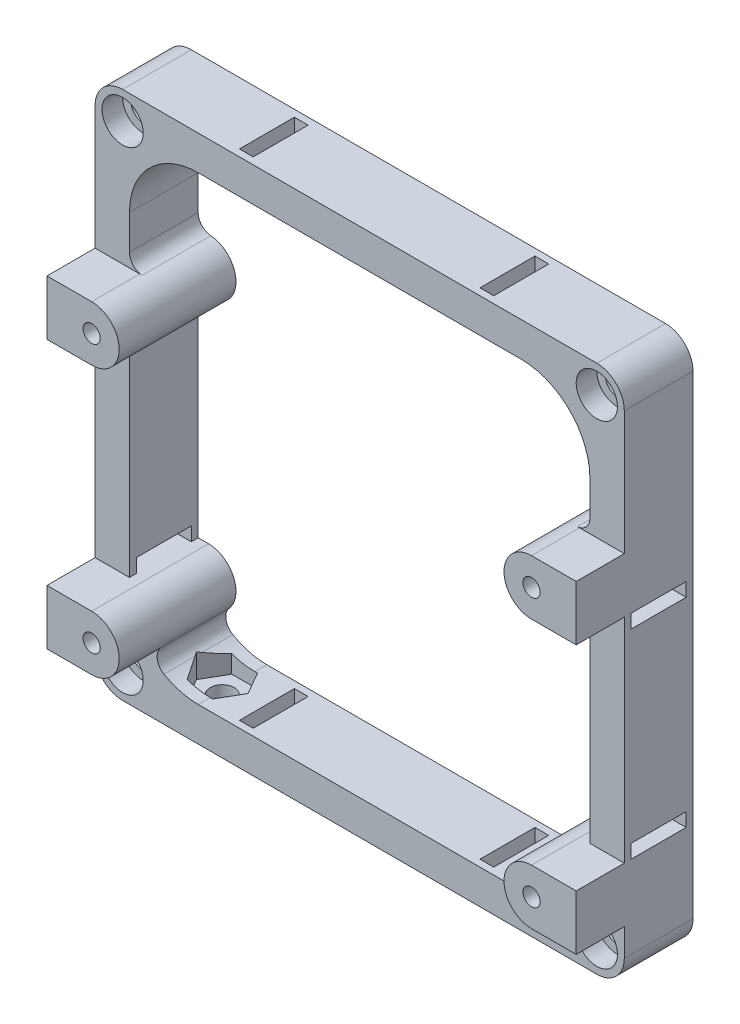
from build123d import *

# Parameters (mm, degrees)
SKETCH1_W               = 77
SKETCH1_H               = 77
SKETCH1_W_2             = 67
SKETCH1_H_2             = 67
EXTRUDE_THIN1_DEPTH     = 10
FILLET2_R               = 10
FILLET1_R               = 4
SKETCH2_R               = 1.7500000000000038
CUT_EXTRUDE1_DEPTH      = 56.35792626173781
SKETCH3_R               = 3.0000000000000018
CUT_EXTRUDE2_DEPTH      = 3
MIRROR2_COPY_1_SKETCH_R = 1.7500000000000038
MIRROR2_COPY_1_DEPTH    = 56.35792626173781
MIRROR2_COPY_2_SKETCH_R = 3.0000000000000018
MIRROR2_COPY_2_DEPTH    = 3
BOSS_EXTRUDE2_DEPTH     = 17
SKETCH5_R               = 1.2499999999999978
CUT_EXTRUDE3_DEPTH      = 8
LPATTERN1_COUNT         = 2
LPATTERN1_PITCH         = 39
MIRROR3_COPY_1_DEPTH    = 17
MIRROR3_COPY_2_SKETCH_R = 1.2499999999999978
MIRROR3_COPY_2_DEPTH    = 8
CUT_EXTRUDE6_REACH      = 89.751
SKETCH9_R               = 1.7500000000000002
CUT_EXTRUDE7_REACH      = 92.751
CUT_EXTRUDE7_START      = -3
CUT_EXTRUDE8_START      = 1
SKETCH11_W              = 4.999999999999986
SKETCH11_H              = 1.9999999999999991
CUT_EXTRUDE8_DEPTH      = 8
LPATTERN2_COUNT         = 2
LPATTERN2_PITCH         = 29
MIRROR5_START           = 1
MIRROR5_COPY_1_SKETCH_W = 4.999999999999986
MIRROR5_COPY_1_SKETCH_H = 1.9999999999999991
MIRROR5_COPY_1_DEPTH    = 8
CUT_EXTRUDE9_START      = 1
CUT_EXTRUDE9_DEPTH      = 8
FILLET3_R               = 2
FILLET4_R               = 2


with BuildPart() as part:
    # Sketch1 → Extrude-Thin1 (new body)
    with BuildSketch(Plane.XY):
        Rectangle(SKETCH1_W, SKETCH1_H)
        Rectangle(SKETCH1_W_2, SKETCH1_H_2, mode=Mode.SUBTRACT)
    extrude(amount=EXTRUDE_THIN1_DEPTH)

    # Fillet2
    fillet2_edges = [part.edges().sort_by_distance(p)[0] for p in [
        (33.49999999999999, -33.50000000000001, 5),
        (33.49999999999999, 33.49999999999999, 5),
        (-33.50000000000001, 33.49999999999999, 5),
        (-33.50000000000001, -33.50000000000001, 5),
    ]]
    fillet(fillet2_edges, radius=FILLET2_R)

    # Fillet1
    fillet1_edges = [part.edges().sort_by_distance(p)[0] for p in [
        (38.49999999999999, -38.50000000000001, 5),
        (-38.50000000000001, -38.50000000000001, 5),
        (-38.50000000000001, 38.49999999999999, 5),
        (38.49999999999999, 38.49999999999999, 5),
    ]]
    fillet(fillet1_edges, radius=FILLET1_R)

    # Sketch2 → Cut-Extrude1 (cut, through all)
    with BuildSketch(Plane.XY.offset(10)):
        with Locations((-34.5, 34.499999999999986)):
            Circle(SKETCH2_R)
    cut_extrude1 = extrude(amount=-CUT_EXTRUDE1_DEPTH, mode=Mode.SUBTRACT)

    # Sketch3 → Cut-Extrude2 (cut)
    with BuildSketch(Plane.XY.offset(10)):
        with Locations((-34.5, 34.499999999999986)):
            Circle(SKETCH3_R)
    cut_extrude2 = extrude(amount=-CUT_EXTRUDE2_DEPTH, mode=Mode.SUBTRACT)

    # Mirror1: Cut-Extrude1, Cut-Extrude2 across plane
    add(cut_extrude1.mirror(Plane(origin=(0, 0, 0), x_dir=(0, 0, 1), z_dir=(1, 0, 0))), mode=Mode.SUBTRACT)
    add(cut_extrude2.mirror(Plane(origin=(0, 0, 0), x_dir=(0, 0, 1), z_dir=(1, 0, 0))), mode=Mode.SUBTRACT)

    # Mirror2: Cut-Extrude1, Cut-Extrude2 across plane
    add(cut_extrude1.mirror(Plane.ZX), mode=Mode.SUBTRACT)
    add(cut_extrude2.mirror(Plane.ZX), mode=Mode.SUBTRACT)

    # Mirror2 copy 1 sketch → Mirror2 copy 1 (cut, through all)
    with BuildSketch(Plane(origin=(0, 0, 10), x_dir=(-1, 0, 0), z_dir=(0, 0, 1))):
        with Locations((-34.5, 34.499999999999986)):
            Circle(MIRROR2_COPY_1_SKETCH_R)
    extrude(amount=-MIRROR2_COPY_1_DEPTH, mode=Mode.SUBTRACT)

    # Mirror2 copy 2 sketch → Mirror2 copy 2 (cut)
    with BuildSketch(Plane(origin=(0, 0, 10), x_dir=(-1, 0, 0), z_dir=(0, 0, 1))):
        with Locations((-34.5, 34.499999999999986)):
            Circle(MIRROR2_COPY_2_SKETCH_R)
    extrude(amount=-MIRROR2_COPY_2_DEPTH, mode=Mode.SUBTRACT)

    # Sketch4 → Boss-Extrude2 (add)
    with BuildSketch(Plane.XY):
        with BuildLine():
            Line((38.49999999999999, -30.500000000000007), (32, -30.500000000000007))
            ThreePointArc((32, -30.500000000000007), (28, -26.500000000000007), (32, -22.500000000000007))
            Line((32, -22.500000000000007), (38.49999999999999, -22.500000000000007))
            Line((38.49999999999999, -22.500000000000007), (38.49999999999999, -30.500000000000007))
        make_face()
    boss_extrude2 = extrude(amount=BOSS_EXTRUDE2_DEPTH)

    # Sketch5 → Cut-Extrude3 (cut)
    with BuildSketch(Plane.XY.offset(17)):
        with Locations((32, -26.500000000000007)):
            Circle(SKETCH5_R)
    cut_extrude3 = extrude(amount=-CUT_EXTRUDE3_DEPTH, mode=Mode.SUBTRACT)

    # LPattern1: Boss-Extrude2, Cut-Extrude3 ×2
    with Locations(*[(0, i * LPATTERN1_PITCH, 0) for i in range(1, LPATTERN1_COUNT)]):
        add(boss_extrude2)
        add(cut_extrude3, mode=Mode.SUBTRACT)

    # Mirror3: Boss-Extrude2, Cut-Extrude3 across plane
    add(boss_extrude2.mirror(Plane(origin=(0, 0, 0), x_dir=(0, 0, 1), z_dir=(1, 0, 0))))
    add(cut_extrude3.mirror(Plane(origin=(0, 0, 0), x_dir=(0, 0, 1), z_dir=(1, 0, 0))), mode=Mode.SUBTRACT)

    # Mirror3 copy 1 sketch → Mirror3 copy 1 (add)
    with BuildSketch(Plane(origin=(0, 39, 0), x_dir=(-1, 0, 0), z_dir=(0, 0, 1))):
        with BuildLine():
            Line((38.49999999999999, 30.500000000000007), (32, 30.500000000000007))
            ThreePointArc((32, 30.500000000000007), (28, 26.500000000000007), (32, 22.500000000000007))
            Line((32, 22.500000000000007), (38.49999999999999, 22.500000000000007))
            Line((38.49999999999999, 22.500000000000007), (38.49999999999999, 30.500000000000007))
        make_face()
    extrude(amount=MIRROR3_COPY_1_DEPTH)

    # Mirror3 copy 2 sketch → Mirror3 copy 2 (cut)
    with BuildSketch(Plane(origin=(0, 39, 17), x_dir=(-1, 0, 0), z_dir=(0, 0, 1))):
        with Locations((32, 26.500000000000007)):
            Circle(MIRROR3_COPY_2_SKETCH_R)
    extrude(amount=-MIRROR3_COPY_2_DEPTH, mode=Mode.SUBTRACT)

    # Sketch9 → Cut-Extrude6 (cut, up to next)
    with BuildSketch(Plane.XZ.offset(38.50000000000001), mode=Mode.PRIVATE) as cut_extrude6_sk1:
        with Locations(Location((-25, 5.000000000000001, 0), (0, 0, 270))):
            Circle(SKETCH9_R)
    cut_extrude6_tool1 = extrude(cut_extrude6_sk1.sketch, amount=-CUT_EXTRUDE6_REACH, mode=Mode.PRIVATE) & part.part
    cut_extrude6 = cut_extrude6_tool1.solids().sort_by_distance((-25, -38.5, 5))[0]
    add(cut_extrude6, mode=Mode.SUBTRACT)

    # Sketch10 → Cut-Extrude7 (cut, up to next)
    with BuildSketch(Plane.XZ.offset(38.50000000000001).offset(CUT_EXTRUDE7_START), mode=Mode.PRIVATE) as cut_extrude7_sk1:
        Polygon((-21.247223250267435, 4.999999999999997), (-23.123611625133723, 8.250000000000002), (-26.876388374866284, 8.250000000000002), (-28.75277674973257, 5.000000000000003), (-26.876388374866284, 1.7500000000000024), (-23.123611625133716, 1.7500000000000024), align=None)
    cut_extrude7_tool1 = extrude(cut_extrude7_sk1.sketch, amount=-CUT_EXTRUDE7_REACH, mode=Mode.PRIVATE) & part.part
    cut_extrude7 = cut_extrude7_tool1.solids().sort_by_distance((-25, -35.5, 5))[0]
    add(cut_extrude7, mode=Mode.SUBTRACT)

    # Mirror4: Cut-Extrude6, Cut-Extrude7 across plane
    add(cut_extrude6.mirror(Plane(origin=(0, 0, 0), x_dir=(0, 0, 1), z_dir=(1, 0, 0))), mode=Mode.SUBTRACT)
    add(cut_extrude7.mirror(Plane(origin=(0, 0, 0), x_dir=(0, 0, 1), z_dir=(1, 0, 0))), mode=Mode.SUBTRACT)

    # Sketch11 → Cut-Extrude8 (cut)
    with BuildSketch(Plane.XY.offset(CUT_EXTRUDE8_START)):
        with Locations((-36, 7.499999999999993)):
            Rectangle(SKETCH11_W, SKETCH11_H)
    cut_extrude8 = extrude(amount=CUT_EXTRUDE8_DEPTH, mode=Mode.SUBTRACT)

    # LPattern2: Cut-Extrude8 ×2
    with Locations(*[(0, -i * LPATTERN2_PITCH, 0) for i in range(1, LPATTERN2_COUNT)]):
        add(cut_extrude8, mode=Mode.SUBTRACT)

    # Mirror5: Cut-Extrude8 across plane
    add(cut_extrude8.mirror(Plane(origin=(0, 0, 0), x_dir=(0, 0, 1), z_dir=(1, 0, 0))), mode=Mode.SUBTRACT)

    # Mirror5 copy 1 sketch → Mirror5 copy 1 (cut)
    with BuildSketch(Plane(origin=(0, -29, 0), x_dir=(-1, 0, 0), z_dir=(0, 0, 1)).offset(MIRROR5_START)):
        with Locations((-36, -7.499999999999993)):
            Rectangle(MIRROR5_COPY_1_SKETCH_W, MIRROR5_COPY_1_SKETCH_H)
    extrude(amount=MIRROR5_COPY_1_DEPTH, mode=Mode.SUBTRACT)

    # Sketch12 → Cut-Extrude9 (cut)
    with BuildSketch(Plane.XY.offset(CUT_EXTRUDE9_START)):
        Polygon((-18.500000000000004, 38.49999999999999), (-16.5, 38.49999999999999), (-16.49999999999999, -38.50000000000001), (-18.499999999999993, -38.50000000000001), align=None)
    cut_extrude9 = extrude(amount=CUT_EXTRUDE9_DEPTH, mode=Mode.SUBTRACT)

    # Fillet3
    # the kernel refuses this fillet: 2 mm, written as the material it adds along each edge
    with BuildSketch(Plane(origin=(-30.8135340936457, -30.319986734670543, 0), x_dir=(0.7836645643351602, -0.6211842324185182, 0), z_dir=(0, 0, 1))) as fillet3_piece_1_section:
        with BuildLine():
            CenterArc((2.6908007118595028, 1.9775267990850256), FILLET3_R, 177.3343308383769, 101.26297954603814)
            ThreePointArc((0.6929648694973664, 2.0705426416774246), (0.49049353406767626, 0.9870739881023467), (0, 0))
            ThreePointArc((0, 0), (1.4948892843663875, -0.1123660045748809), (2.9897785687327803, -7e-17))
        make_face()
    fillet3_piece_1 = extrude(amount=10, mode=Mode.PRIVATE)
    fillet3_piece_1 = split(fillet3_piece_1, bisect_by=Plane(origin=(-27.54913565092657, -30.645363092705114, 2.915232462789981), z_dir=(-0.8660254037844386, 0, -0.5000000000000001)), keep=Keep.TOP, mode=Mode.PRIVATE)
    fillet3_piece_1 = split(fillet3_piece_1, bisect_by=Plane(origin=(-30.43600370177841, -30.645363092705114, 2.084565398387304), z_dir=(0.8660254037844387, 0, -0.5000000000000003)), keep=Keep.TOP, mode=Mode.PRIVATE)
    add(fillet3_piece_1)
    with BuildSketch(Plane(origin=(-30.8135340936457, -30.319986734670543, 0), x_dir=(0.7836645643351602, -0.6211842324185182, 0), z_dir=(0, 0, 1))) as fillet3_piece_2_section:
        with BuildLine():
            CenterArc((2.6908007118595028, 1.9775267990850256), FILLET3_R, 177.3343308383769, 101.26297954603814)
            ThreePointArc((0.6929648694973664, 2.0705426416774246), (0.49049353406767626, 0.9870739881023467), (0, 0))
            ThreePointArc((0, 0), (1.4948892843663875, -0.1123660045748809), (2.9897785687327803, -7e-17))
        make_face()
    fillet3_piece_2 = extrude(amount=10, mode=Mode.PRIVATE)
    fillet3_piece_2 = split(fillet3_piece_2, bisect_by=Plane(origin=(-29.05636390138043, -30.536998360213005, 5.525828371179215), z_dir=(-0.8660254037844386, 0, -0.5000000000000001)), keep=Keep.TOP, mode=Mode.PRIVATE)
    fillet3_piece_2 = split(fillet3_piece_2, bisect_by=Plane(origin=(-29.056363901380575, -30.536998360213005, 4.474171628820541), z_dir=(-0.8660254037844387, 0, 0.5000000000000003)), keep=Keep.TOP, mode=Mode.PRIVATE)
    add(fillet3_piece_2)
    with BuildSketch(Plane(origin=(-30.8135340936457, -30.319986734670543, 0), x_dir=(0.7836645643351602, -0.6211842324185182, 0), z_dir=(0, 0, 1))) as fillet3_piece_3_section:
        with BuildLine():
            CenterArc((2.6908007118595028, 1.9775267990850256), FILLET3_R, 177.3343308383769, 101.26297954603814)
            ThreePointArc((0.6929648694973664, 2.0705426416774246), (0.49049353406767626, 0.9870739881023467), (0, 0))
            ThreePointArc((0, 0), (1.4948892843663875, -0.1123660045748809), (2.9897785687327803, -7e-17))
        make_face()
    fillet3_piece_3 = extrude(amount=10, mode=Mode.PRIVATE)
    fillet3_piece_3 = split(fillet3_piece_3, bisect_by=Plane(origin=(-30.436003701778844, -30.6453630927051, 7.915434601613452), z_dir=(0.8660254037844386, 0, 0.5000000000000001)), keep=Keep.TOP, mode=Mode.PRIVATE)
    fillet3_piece_3 = split(fillet3_piece_3, bisect_by=Plane(origin=(-27.54913565092623, -30.6453630927051, 7.084767537210608), z_dir=(-0.8660254037844387, 0, 0.5000000000000003)), keep=Keep.TOP, mode=Mode.PRIVATE)
    add(fillet3_piece_3)
    with BuildSketch(Plane(origin=(30.813534093645686, -30.31998673467054, 0), x_dir=(-0.8377846693209525, 0.5460007764195783, 0), z_dir=(0, 0, 1))) as fillet3_piece_4_section:
        with BuildLine():
            CenterArc((2.729281940067415, 1.9240688146905967), FILLET3_R, 152.89843442949885, 101.2629795460382)
            ThreePointArc((0.9488812264558188, 2.835207277807654), (0.3678839212773398, 1.4532658091220572), (0, 0))
            ThreePointArc((0, 0), (1.091712776026968, 0.15186237061880967), (2.183425552053934, 1.9e-16))
        make_face()
    fillet3_piece_4 = extrude(amount=10, mode=Mode.PRIVATE)
    fillet3_piece_4 = split(fillet3_piece_4, bisect_by=Plane(origin=(30.436003705842438, -30.64536309093321, 2.084565391348203), z_dir=(-0.8660254037844386, 0, -0.5000000000000003)), keep=Keep.TOP, mode=Mode.PRIVATE)
    fillet3_piece_4 = split(fillet3_piece_4, bisect_by=Plane(origin=(27.549135647094026, -30.64536309093321, 2.915232456151825), z_dir=(0.8660254037844386, 0, -0.5000000000000001)), keep=Keep.TOP, mode=Mode.PRIVATE)
    add(fillet3_piece_4)
    with BuildSketch(Plane(origin=(30.813534093645686, -30.31998673467054, 0), x_dir=(-0.8377846693209525, 0.5460007764195783, 0), z_dir=(0, 0, 1))) as fillet3_piece_5_section:
        with BuildLine():
            CenterArc((2.729281940067415, 1.9240688146905967), FILLET3_R, 152.89843442949885, 101.2629795460382)
            ThreePointArc((0.9488812264558188, 2.835207277807654), (0.3678839212773398, 1.4532658091220572), (0, 0))
            ThreePointArc((0, 0), (1.091712776026968, 0.15186237061880967), (2.183425552053934, 1.9e-16))
        make_face()
    fillet3_piece_5 = extrude(amount=10, mode=Mode.PRIVATE)
    fillet3_piece_5 = split(fillet3_piece_5, bisect_by=Plane(origin=(29.056363901218514, -30.53699836176434, 4.474171629101236), z_dir=(0.8660254037844386, 0, 0.5000000000000003)), keep=Keep.TOP, mode=Mode.PRIVATE)
    fillet3_piece_5 = split(fillet3_piece_5, bisect_by=Plane(origin=(29.05636390121846, -30.53699836176434, 5.525828370898675), z_dir=(0.8660254037844386, 0, -0.5000000000000001)), keep=Keep.TOP, mode=Mode.PRIVATE)
    add(fillet3_piece_5)
    with BuildSketch(Plane(origin=(30.813534093645686, -30.31998673467054, 0), x_dir=(-0.8377846693209525, 0.5460007764195783, 0), z_dir=(0, 0, 1))) as fillet3_piece_6_section:
        with BuildLine():
            CenterArc((2.729281940067415, 1.9240688146905967), FILLET3_R, 152.89843442949885, 101.2629795460382)
            ThreePointArc((0.9488812264558188, 2.835207277807654), (0.3678839212773398, 1.4532658091220572), (0, 0))
            ThreePointArc((0, 0), (1.091712776026968, 0.15186237061880967), (2.183425552053934, 1.9e-16))
        make_face()
    fillet3_piece_6 = extrude(amount=10, mode=Mode.PRIVATE)
    fillet3_piece_6 = split(fillet3_piece_6, bisect_by=Plane(origin=(27.549135647093944, -30.64536309093318, 7.084767543848323), z_dir=(0.8660254037844386, 0, 0.5000000000000003)), keep=Keep.TOP, mode=Mode.PRIVATE)
    fillet3_piece_6 = split(fillet3_piece_6, bisect_by=Plane(origin=(30.436003705842538, -30.64536309093318, 7.9154346086519745), z_dir=(-0.8660254037844386, 0, 0.5000000000000001)), keep=Keep.TOP, mode=Mode.PRIVATE)
    add(fillet3_piece_6)

    # Fillet4
    # the kernel refuses this fillet: 2 mm, written as the material it adds along each edge
    with BuildSketch(Plane(origin=(33.49999999999999, 16.499999999999993, 10), x_dir=(0, 1, 0), z_dir=(0, 0, -1))) as fillet4_piece_1:
        with BuildLine():
            CenterArc((1.9791303715507027, -2), FILLET4_R, 90, 85.21980815280071)
            Line((-0.01391308563286486, -1.8333333333333286), (-0.21321743135122162, -1.8166666666666629))
            ThreePointArc((-0.21321743135122162, -1.8166666666666629), (-0.1999999999999993, -1.499999999999993), (-0.1999999999999993, 0))
            Line((-0.1999999999999993, 0), (0, 0.20000000000000284))
            Line((0, 0.20000000000000284), (1.9791303715507027, 0.20000000000000284))
            Line((1.9791303715507027, 0.20000000000000284), (1.9791303715507027, 0))
        make_face()
    extrude(amount=10)
    with BuildSketch(Plane(origin=(-33.50000000000001, 16.499999999999993, 10), x_dir=(0.9999712051187002, -0.0075887372766649565, 0), z_dir=(0, 0, -1))) as fillet4_piece_2:
        with BuildLine():
            CenterArc((1.9849233098114338, -1.9942508572799034), FILLET4_R, 94.34538505600126, 85.21980815280081)
            Line((-0.01501910042596653, -1.9790733827265699), (-0.2150133414497094, -1.977555635271237))
            Line((-0.2150133414497094, -1.977555635271237), (-0.19999424102374289, 0.00151774745533301))
            Line((-0.19999424102374289, 0.00151774745533301), (0.00151774745533299, 0.19999424102373933))
            ThreePointArc((0.00151774745533299, 0.19999424102373933), (1.5014745551333903, 0.18861113510874183), (1.8182324070349718, 0.19942508572799034))
            Line((1.8182324070349718, 0.19942508572799034), (1.833386125469195, 0))
        make_face()
    extrude(amount=10)

    # Mirror6: Cut-Extrude9 across plane
    add(cut_extrude9.mirror(Plane(origin=(0, 0, 0), x_dir=(0, 0, 1), z_dir=(1, 0, 0))), mode=Mode.SUBTRACT)


solid = part.part
